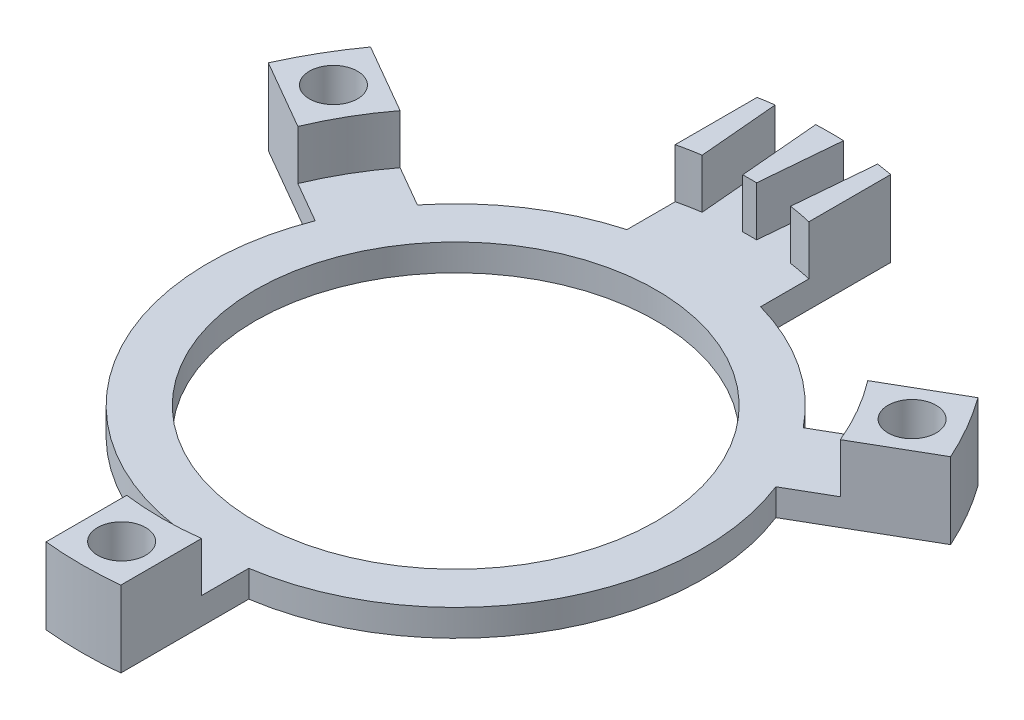
from build123d import *

# Parameters (mm, degrees)
CUT_EXTRUDE1_DEPTH     = 1.85
CUT_EXTRUDE2_START     = -2.85
CUT_EXTRUDE2_OUTLINE_R = 0.9
CUT_EXTRUDE2_DEPTH     = 2.85


# Read off the part's stored shape, not the designer's step: Cut-Extrude2
with BuildPart() as part:
    # Sketch1 → Revolve1 (revolve)
    with BuildSketch(Plane.XY, mode=Mode.PRIVATE) as revolve1_sk:
        Polygon((7.5, 0.9999999999999996), (7.5, 0), (14.000000000000002, 0), (14.000000000000002, 2.8500000000000005), (11.000000000000002, 2.85), (11.000000000000002, 1), align=None)
    revolve(revolve1_sk.sketch.rotate(Axis((3e-17, 0.9999999999999987, 0), (-3e-17, -1, 0)), 180), axis=Axis((3e-17, 0.9999999999999987, 0), (-3e-17, -1, 0)))

    # Sketch2 → Cut-Extrude1 (cut)
    with BuildSketch(Plane(origin=(9e-17, 2.8500000000000005, 0), x_dir=(1, -3e-17, 0), z_dir=(3e-17, 1, 0))):
        with BuildLine():
            ThreePointArc((0.259433716221758, 10.996940217482653), (0.6093823027349546, 10.983107629861117), (0.9587131702244344, 10.958141679009186))
            Line((0.9587131702242476, 10.9581416790092), (1.2201803984672228, 13.946725773284436))
            ThreePointArc((1.2201803984672233, 13.946725773284438), (0.8710215713285331, 13.97287806510457), (0.521317929845157, 13.99029047647053))
            Line((0.5213179298455201, 13.99029047647048), (0.25943371622169603, 10.996940217482662))
        make_face()
        with BuildLine():
            Line((1.2201803984672228, 13.946725773284436), (0.9587131702242476, 10.9581416790092))
            ThreePointArc((0.9587131702244344, 10.958141679009186), (1.3070722087636013, 10.922067672427135), (1.6541062935502489, 10.874922177635916))
            Line((1.6541062935501436, 10.874922177635918), (1.9159905071739696, 13.868272436623787))
            ThreePointArc((1.9159905071740335, 13.868272436623785), (1.5685760162822768, 13.911849958979003), (1.2201803984672233, 13.946725773284438))
        make_face()
        with BuildLine():
            Line((-1.9159905071739802, 13.868272436623787), (-1.654106293550152, 10.874922177635916))
            ThreePointArc((-1.654106293550262, 10.874922177635913), (-0.9587131702243502, 10.958141679009193), (-0.25943371622180056, 10.996940217482653))
            Line((-0.259433716221705, 10.996940217482667), (-0.5213179298455309, 13.990290476470479))
            ThreePointArc((-0.5213179298451552, 13.99029047647053), (-0.8710219940751529, 13.97287803875198), (-1.2201812423779956, 13.946725699451788))
            ThreePointArc((-1.2201812423779956, 13.946725699451788), (-1.5685764371825126, 13.911849911522042), (-1.9159905071740533, 13.868272436623784))
        make_face()
    extrude(amount=-CUT_EXTRUDE1_DEPTH, mode=Mode.SUBTRACT)

    # Cut-Extrude2 outline → Cut-Extrude2 (cut)
    with BuildSketch(Plane(origin=(9e-17, 2.8500000000000005, 0), x_dir=(1, -3e-17, 0), z_dir=(3e-17, 1, 0)).offset(CUT_EXTRUDE2_START)):
        with BuildLine():
            ThreePointArc((8.618451553, 3.35928457), (8.010734985, -4.625), (1.4, -9.143440272))
            Line((1.4, -9.143440272), (1.4, -13.929824119))
            ThreePointArc((1.4, -13.929824119), (12.124355653, -7), (12.763581558, 5.752476494))
            Line((12.763581558, 5.752476494), (8.618451553, 3.35928457))
        make_face()
        with BuildLine():
            Line((-8.618451553, 3.35928457), (-12.763581558, 5.752476494))
            ThreePointArc((-12.763581558, 5.752476494), (-12.124355653, -7), (-1.4, -13.929824119))
            Line((-1.4, -13.929824119), (-1.4, -9.143440272))
            ThreePointArc((-1.4, -9.143440272), (-8.010734985, -4.625), (-8.618451553, 3.35928457))
        make_face()
        with BuildLine():
            Line((2.5, 13.774977314), (2.5, 8.905756565))
            ThreePointArc((2.5, 8.905756565), (5.103741092, 7.714552927), (7.218451553, 5.784155701))
            Line((7.218451553, 5.784155701), (11.363581558, 8.177347625))
            ThreePointArc((11.363581558, 8.177347625), (7.475499176, 11.837098972), (2.5, 13.774977314))
        make_face()
        with BuildLine():
            Line((-2.5, 8.905756565), (-2.5, 13.774977314))
            ThreePointArc((-2.5, 13.774977314), (-7.475499176, 11.837098972), (-11.363581558, 8.177347625))
            Line((-11.363581558, 8.177347625), (-7.218451553, 5.784155701))
            ThreePointArc((-7.218451553, 5.784155701), (-5.103741092, 7.714552927), (-2.5, 8.905756565))
        make_face()
        with Locations((-10.825317547, 6.25)):
            Circle(CUT_EXTRUDE2_OUTLINE_R)
        with Locations((0, -12.5)):
            Circle(CUT_EXTRUDE2_OUTLINE_R)
        with Locations((10.825317547, 6.25)):
            Circle(CUT_EXTRUDE2_OUTLINE_R)
    extrude(amount=CUT_EXTRUDE2_DEPTH, mode=Mode.SUBTRACT)


solid = part.part
